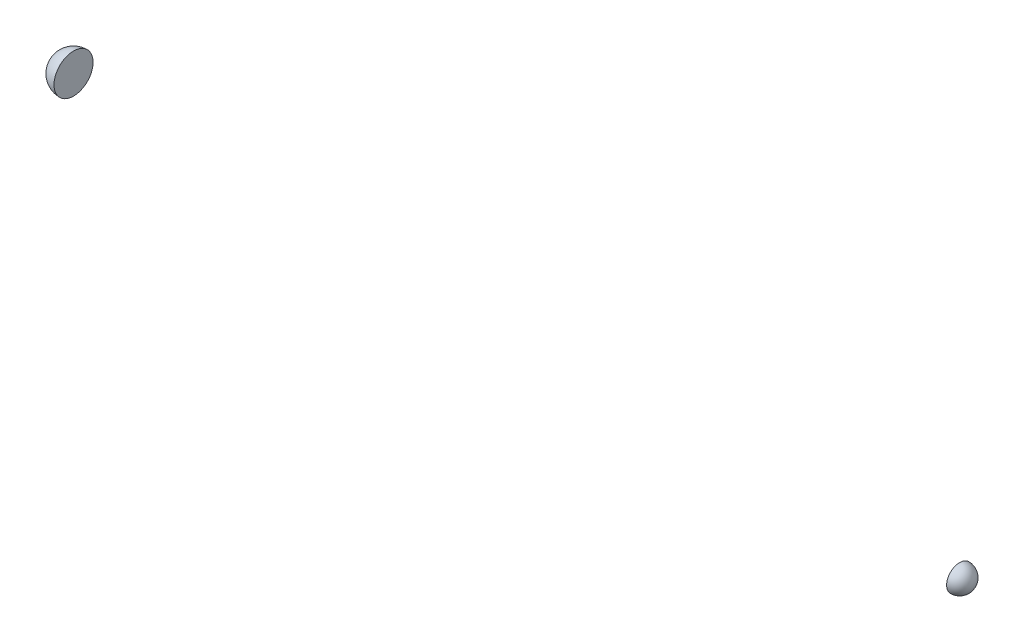
from build123d import *


# Read off the part's stored shape, not the designer's step: Revolve1
with BuildPart() as part:
    # Revolve1 outline → Revolve1 (revolve)
    with BuildSketch(Plane(origin=(0, 1477.746786851, 0), x_dir=(0, 1, 0), z_dir=(0, 0, -1))):
        with BuildLine():
            Line((375.000147916, -9382.267323072), (0, -9382.267323172))
            Line((0, -9382.267323172), (0, -9757.267471087))
            ThreePointArc((0, -9757.267471087), (265.165147573, -9647.432470673), (375.000147916, -9382.267323072))
        make_face()
    revolve(axis=Axis((0, 1477.746786851, 0), (1, 0, 0)))


with BuildPart() as body_2:
    # Sketch31 → Revolve2 (revolve)
    with BuildSketch(Plane.XY):
        with BuildLine():
            Line((7617.732676828, 1852.746934767), (7617.732676828, 1602.746977946))
            Line((7617.732676828, 1602.746977946), (7867.732633649, 1602.746977946))
            ThreePointArc((7867.732633649, 1602.746977946), (7794.509341592, 1779.52364271), (7617.732676828, 1852.746934767))
        make_face()
    revolve(axis=Axis((7617.732676828, 1602.746977946, 0), (1, 0, 0)))


solid = Compound([part.part, body_2.part])
